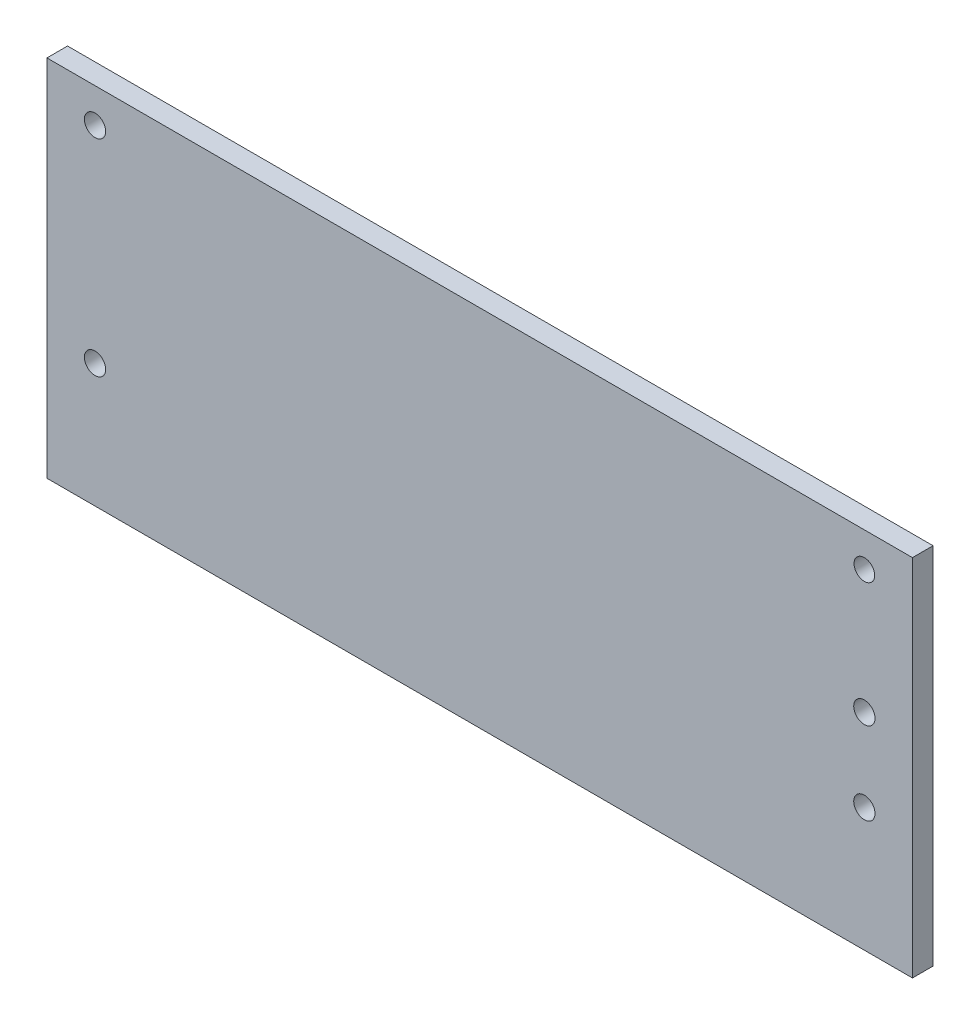
from build123d import *

# Parameters (mm, degrees)
SKETCH_1_W          = 126
SKETCH_1_H          = 53
EXTRUDE_1_DEPTH     = 3
SKETCH_2_R          = 1.55
SKETCH_2_R_2        = 1.5
CUT_EXTRUDE_1_DEPTH = 10
SKETCH_3_R          = 1.55
CUT_EXTRUDE_2_DEPTH = 10
SKETCH_5_R          = 1.55
CUT_EXTRUDE_5_DEPTH = 10


with BuildPart() as part:
    # 草图1 → 凸台-拉伸1 (new body)
    with BuildSketch(Plane.XY):
        Rectangle(SKETCH_1_W, SKETCH_1_H)
    extrude(amount=EXTRUDE_1_DEPTH)

    # 草图2 → 切除-拉伸1 (cut)
    with BuildSketch(Plane(origin=(0, 0, 0), x_dir=(-1, 0, 0), z_dir=(0, 0, -1))):
        with Locations((56, 21.5)):
            Circle(SKETCH_2_R)
        with Locations((-56, 21.5)):
            Circle(SKETCH_2_R_2)
    extrude(amount=-CUT_EXTRUDE_1_DEPTH, mode=Mode.SUBTRACT)

    # 草图3 → 切除-拉伸2 (cut)
    with BuildSketch(Plane.XY.offset(3)):
        with Locations((-56, -8.5)):
            Circle(SKETCH_3_R)
        with Locations((56, -8.5)):
            Circle(SKETCH_3_R)
    extrude(amount=-CUT_EXTRUDE_2_DEPTH, mode=Mode.SUBTRACT)

    # 草图5 → 切除-拉伸5 (cut)
    with BuildSketch(Plane.XY.offset(3)):
        with Locations((56, 3.5)):
            Circle(SKETCH_5_R)
    extrude(amount=-CUT_EXTRUDE_5_DEPTH, mode=Mode.SUBTRACT)


solid = part.part
